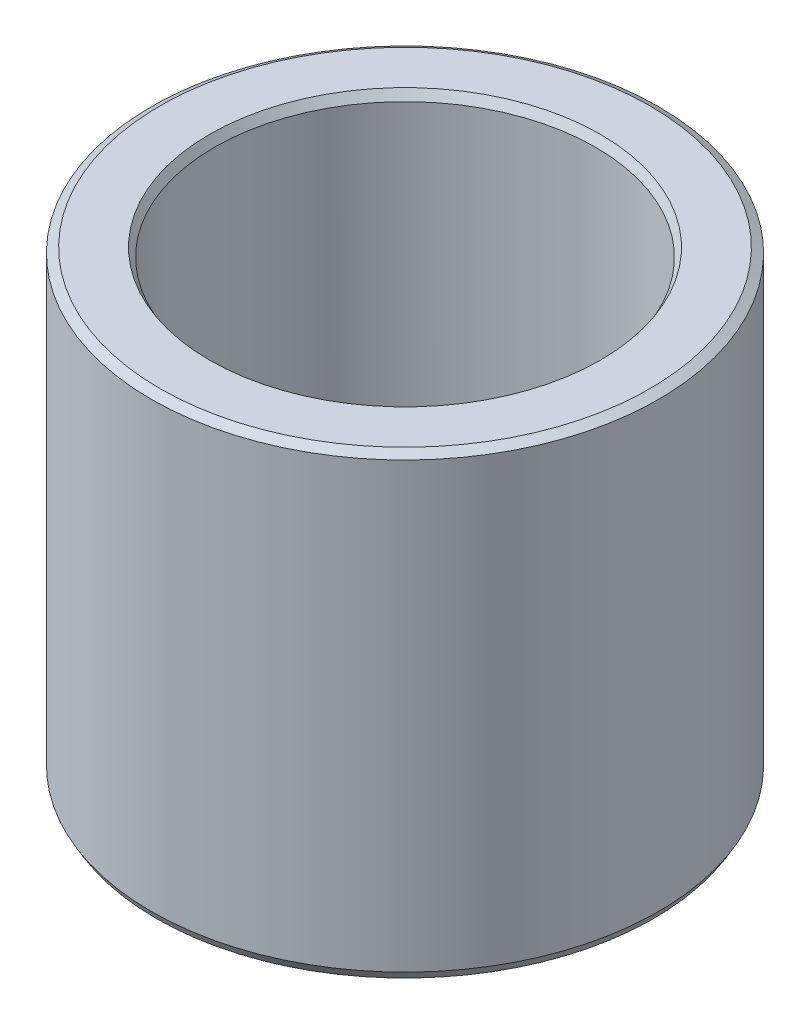
from build123d import *
from OCP.BRepFilletAPI import BRepFilletAPI_MakeChamfer

# Parameters (mm, degrees)
SKETCH1_R           = 50
BOSS_EXTRUDE1_DEPTH = 90.139843424
SKETCH2_R           = 37.57295954
CUT_EXTRUDE1_DEPTH  = 115.565227589
CHAMFER1_SIZE       = 0.982376876
CHAMFER1_SIZE2      = 1.701526662


with BuildPart() as part:
    # Sketch1 → Boss-Extrude1 (new body)
    with BuildSketch(Plane(origin=(0, 0, 0), x_dir=(1, 0, 0), z_dir=(0, 1, 0))):
        Circle(SKETCH1_R)
    extrude(amount=BOSS_EXTRUDE1_DEPTH)

    # Sketch2 → Cut-Extrude1 (cut, through all)
    with BuildSketch(Plane(origin=(0, 0, 0), x_dir=(1, 0, 0), z_dir=(0, 1, 0))):
        Circle(SKETCH2_R)
    extrude(amount=CUT_EXTRUDE1_DEPTH, mode=Mode.SUBTRACT)

    # Chamfer1: one chamfer whose edges measure the first distance from different faces: ONE call of the kernel's chamfer builder (chamfer() names one face for all edges)
    chamfer1_edges_1 = [part.edges().sort_by_distance(p)[0] for p in [
        (-37.57295954, 90.139843424, 0),
    ]]
    chamfer1_side_1 = [part.faces().sort_by_distance(p)[0] for p in [
        (-48.585786438, 90.139843424, 0),
    ]]
    chamfer1_edges_2 = [part.edges().sort_by_distance(p)[0] for p in [
        (-37.57295954, 0, 0),
    ]]
    chamfer1_side_2 = [part.faces().sort_by_distance(p)[0] for p in [
        (-37.57295954, 45.069921712, 0),
    ]]
    chamfer1_edges_3 = [part.edges().sort_by_distance(p)[0] for p in [
        (-50, 0, 0),
    ]]
    chamfer1_side_3 = [part.faces().sort_by_distance(p)[0] for p in [
        (-48.585786438, 0, 0),
    ]]
    chamfer1_edges_4 = [part.edges().sort_by_distance(p)[0] for p in [
        (-50, 90.139843424, 0),
    ]]
    chamfer1_side_4 = [part.faces().sort_by_distance(p)[0] for p in [
        (-50, 45.069921712, 0),
    ]]
    chamfer1 = BRepFilletAPI_MakeChamfer(part.part.solid().wrapped)
    for e in chamfer1_edges_1:
        chamfer1.Add(CHAMFER1_SIZE, CHAMFER1_SIZE2, e.wrapped, chamfer1_side_1[0].wrapped)  # the first distance lies on this face
    for e in chamfer1_edges_2:
        chamfer1.Add(CHAMFER1_SIZE, CHAMFER1_SIZE2, e.wrapped, chamfer1_side_2[0].wrapped)  # the first distance lies on this face
    for e in chamfer1_edges_3:
        chamfer1.Add(CHAMFER1_SIZE, CHAMFER1_SIZE2, e.wrapped, chamfer1_side_3[0].wrapped)  # the first distance lies on this face
    for e in chamfer1_edges_4:
        chamfer1.Add(CHAMFER1_SIZE, CHAMFER1_SIZE2, e.wrapped, chamfer1_side_4[0].wrapped)  # the first distance lies on this face
    add(Compound.cast(chamfer1.Shape()), mode=Mode.REPLACE)


solid = part.part
